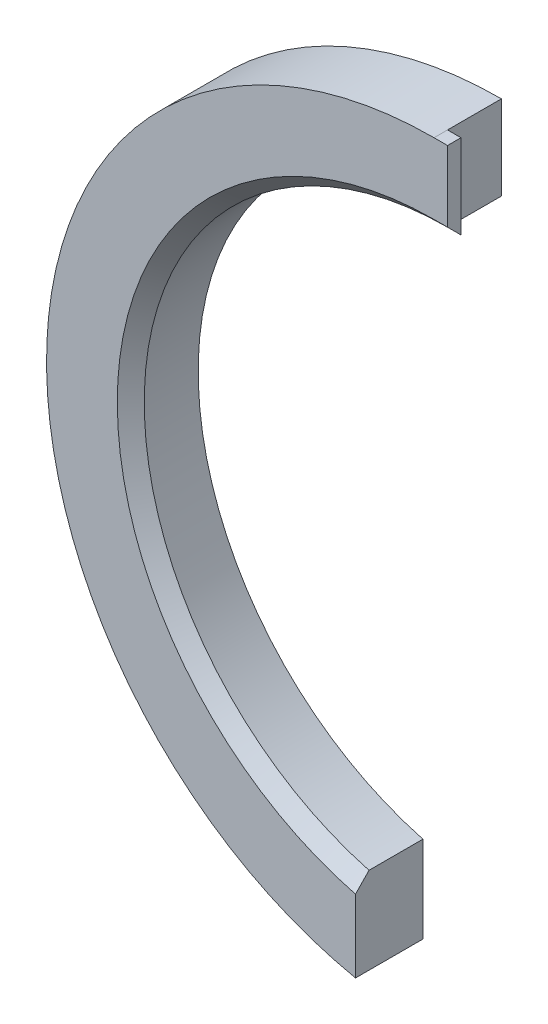
from build123d import *

# Parameters (mm, degrees)
SKETCH1_R           = 57.5
SKETCH1_R_2         = 45
BOSS_EXTRUDE1_DEPTH = 10
CUT_EXTRUDE2_DEPTH  = 10
CHAMFER1_SIZE       = 2
SKETCH3_W           = 124.113144638
SKETCH3_H           = 66.876500266
CUT_EXTRUDE3_DEPTH  = 10
CUT_EXTRUDE4_START  = -2
SKETCH5_R           = 4
CUT_EXTRUDE4_DEPTH  = 3
BOSS_EXTRUDE2_DEPTH = 2


with BuildPart() as part:
    # Sketch1 → Boss-Extrude1 (new body)
    with BuildSketch(Plane(origin=(0, 0, 0), x_dir=(0, 1, 0), z_dir=(0, 0, 1))):
        Circle(SKETCH1_R)
        Circle(SKETCH1_R_2, mode=Mode.SUBTRACT)
    extrude(amount=BOSS_EXTRUDE1_DEPTH)

    # Sketch2 → Cut-Extrude2 (cut)
    with BuildSketch(Plane(origin=(0, 0, 0), x_dir=(1, 0, 0), z_dir=(0, 0, -1))):
        with BuildLine():
            Line((11.650511373, 56.659857386), (11.650511373, 43.46568284))
            add(Edge.make_bspline(
                [(11.650511373, 43.46568284), (-0.679246558, 46.406413024), (-11.650511373, 43.46568284)],
                knots=[0, 0, 0, 0.575547458, 0.575547458, 0.575547458], degree=2))
            Line((-11.650511373, 43.46568284), (-11.650511373, 56.659857386))
            ThreePointArc((-11.650511373, 56.659857386), (0, 57.845257837), (11.650511373, 56.659857386))
        make_face()
    extrude(amount=-CUT_EXTRUDE2_DEPTH, mode=Mode.SUBTRACT)

    # Chamfer1
    chamfer1_edges = [part.edges().sort_by_distance(p)[0] for p in [
        (0, 45, 10),
    ]]
    chamfer(chamfer1_edges, length=CHAMFER1_SIZE)

    # Sketch3 → Cut-Extrude3 (cut)
    with BuildSketch(Plane(origin=(0, 0, 0), x_dir=(0, 1, 0), z_dir=(0, 0, 1))):
        with Locations((4.641630902, -33.438250133)):
            Rectangle(SKETCH3_W, SKETCH3_H)
    extrude(amount=CUT_EXTRUDE3_DEPTH, mode=Mode.SUBTRACT)

    # Sketch5 → Cut-Extrude4 (cut)
    with BuildSketch(Plane(origin=(0, 0, 0), x_dir=(1, 0, 0), z_dir=(0, 0, -1)).offset(CUT_EXTRUDE4_START)):
        with Locations((-6, -51.25)):
            Circle(SKETCH5_R)
    extrude(amount=-CUT_EXTRUDE4_DEPTH, mode=Mode.SUBTRACT)

    # Sketch6 → Boss-Extrude2 (add)
    with BuildSketch(Plane.YZ):
        Polygon((45, 8), (47, 10), (57.5, 10), (57.5, 8), align=None)
    extrude(amount=BOSS_EXTRUDE2_DEPTH)


solid = part.part
